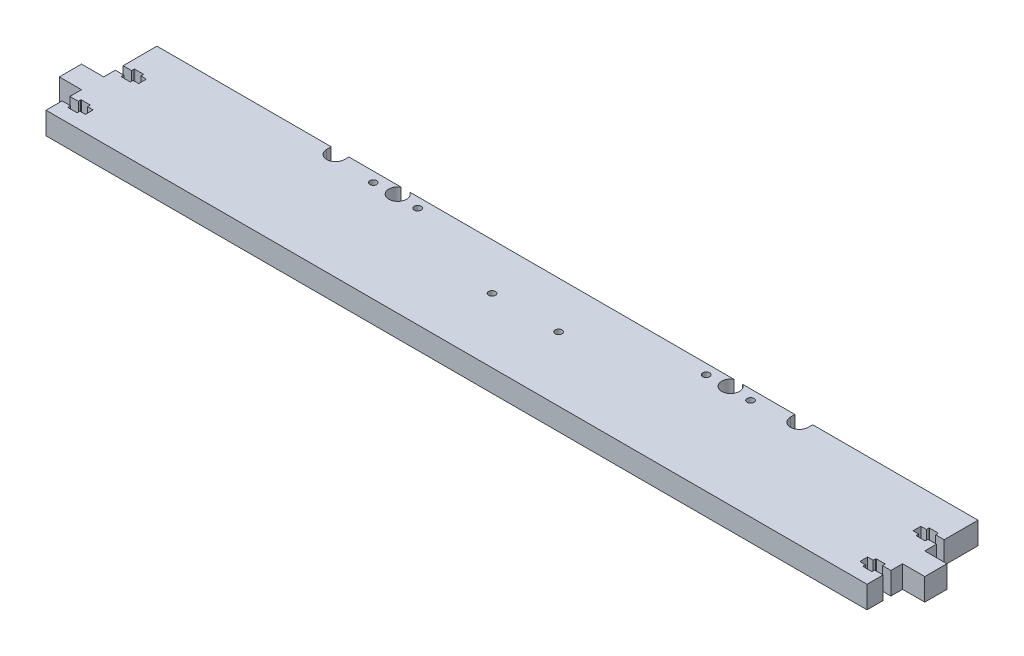
from build123d import *

# Parameters (mm, degrees)
MAINBODY_DEPTH                 = 10
SCREWCUTOUTS_DEPTH             = 197.85019685
SKETCH3_R                      = 4
SKETCH3_R_2                    = 1.55
RODCUTOUTS_DEPTH               = 197.85019685
SKETCH6_R                      = 1.55
CUT_EXTRUDE1_DEPTH             = 197.85019685
BEDADJUSTMENTSCREWCUTOUT_DEPTH = 197.85019685


with BuildPart() as part:
    # Sketch1 → MainBody (new body)
    with BuildSketch(Plane(origin=(0, 0, 0), x_dir=(1, 0, 0), z_dir=(0, 1, 0))):
        Polygon((0, -25), (0, 25), (-185, 25), (-185, 1), (-195, 1), (-195, -9), (-185, -9), (-185, -25), align=None)
    mainbody = extrude(amount=MAINBODY_DEPTH)

    # Sketch5 → ScrewCutouts (cut, through all)
    with BuildSketch(Plane(origin=(0, 10, 0), x_dir=(1, 0, 0), z_dir=(0, 1, 0))):
        with BuildLine():
            Line((-185, 9.75), (-181.2, 9.75))
            Line((-181.2, 9.75), (-181.2, 10.75))
            ThreePointArc((-181.2, 10.75), (-181.126776695, 10.926776695), (-180.95, 11))
            Line((-180.95, 11), (-177.25, 11))
            ThreePointArc((-177.25, 11), (-177.073223305, 10.926776695), (-177, 10.75))
            Line((-177, 10.75), (-177, 9.75))
            Line((-177, 9.75), (-174.5, 9.75))
            Line((-174.5, 9.75), (-174.5, 6.25))
            Line((-174.5, 6.25), (-177, 6.25))
            Line((-177, 6.25), (-177, 5.25))
            ThreePointArc((-177, 5.25), (-177.073223305, 5.073223305), (-177.25, 5))
            Line((-177.25, 5), (-180.95, 5))
            ThreePointArc((-180.95, 5), (-181.126776695, 5.073223305), (-181.2, 5.25))
            Line((-181.2, 5.25), (-181.2, 6.25))
            Line((-181.2, 6.25), (-185, 6.25))
            Line((-185, 6.25), (-185, 9.75))
        make_face()
        with BuildLine():
            Line((-185, -14.25), (-181.2, -14.25))
            Line((-181.2, -14.25), (-181.2, -13.25))
            ThreePointArc((-181.2, -13.25), (-181.126776695, -13.073223305), (-180.95, -13))
            Line((-180.95, -13), (-177.25, -13))
            ThreePointArc((-177.25, -13), (-177.073223305, -13.073223305), (-177, -13.25))
            Line((-177, -13.25), (-177, -14.25))
            Line((-177, -14.25), (-174.5, -14.25))
            Line((-174.5, -14.25), (-174.5, -17.75))
            Line((-174.5, -17.75), (-177, -17.75))
            Line((-177, -17.75), (-177, -18.75))
            ThreePointArc((-177, -18.75), (-177.073223305, -18.926776695), (-177.25, -19))
            Line((-177.25, -19), (-180.95, -19))
            ThreePointArc((-180.95, -19), (-181.126776695, -18.926776695), (-181.2, -18.75))
            Line((-181.2, -18.75), (-181.2, -17.75))
            Line((-181.2, -17.75), (-185, -17.75))
            Line((-185, -17.75), (-185, -14.25))
        make_face()
    screwcutouts = extrude(amount=-SCREWCUTOUTS_DEPTH, mode=Mode.SUBTRACT)

    # Mirror1: MainBody, ScrewCutouts across plane
    add(mainbody.mirror(Plane(origin=(0, 0, 0), x_dir=(0, 0, 1), z_dir=(1, 0, 0))))
    add(screwcutouts.mirror(Plane(origin=(0, 0, 0), x_dir=(0, 0, 1), z_dir=(1, 0, 0))), mode=Mode.SUBTRACT)

    # Sketch3 → RodCutouts (cut, through all)
    with BuildSketch(Plane(origin=(0, 10, 0), x_dir=(1, 0, 0), z_dir=(0, 1, 0))):
        with Locations((-73, 21.5)):
            Circle(SKETCH3_R)
        with Locations((-83, 20.5)):
            Circle(SKETCH3_R_2)
        with Locations((-63, 20.5)):
            Circle(SKETCH3_R_2)
        with Locations((67, 20.5)):
            Circle(SKETCH3_R_2)
        with Locations((87, 20.5)):
            Circle(SKETCH3_R_2)
        with Locations((77, 21.5)):
            Circle(SKETCH3_R)
    extrude(amount=-RODCUTOUTS_DEPTH, mode=Mode.SUBTRACT)

    # Sketch6 → Cut-Extrude1 (cut, through all)
    with BuildSketch(Plane(origin=(0, 10, 0), x_dir=(1, 0, 0), z_dir=(0, 1, 0))):
        with Locations((-13, 4)):
            Circle(SKETCH6_R)
        with Locations((17, 4)):
            Circle(SKETCH6_R)
    extrude(amount=-CUT_EXTRUDE1_DEPTH, mode=Mode.SUBTRACT)

    # Sketch7 → BedAdjustmentScrewCutout (cut, through all)
    with BuildSketch(Plane(origin=(0, 10, 0), x_dir=(1, 0, 0), z_dir=(0, 1, 0))):
        with BuildLine():
            Line((-98.5, 25), (-98.5, 23))
            ThreePointArc((-98.5, 23), (-102.5, 19), (-106.5, 23))
            Line((-106.5, 23), (-106.5, 25))
            ThreePointArc((-106.5, 25), (-102.5, 29), (-98.5, 25))
        make_face()
        with BuildLine():
            Line((102.5, 25), (102.5, 23))
            ThreePointArc((102.5, 23), (106.5, 19), (110.5, 23))
            Line((110.5, 23), (110.5, 25))
            ThreePointArc((110.5, 25), (106.5, 29), (102.5, 25))
        make_face()
    extrude(amount=-BEDADJUSTMENTSCREWCUTOUT_DEPTH, mode=Mode.SUBTRACT)


solid = part.part
